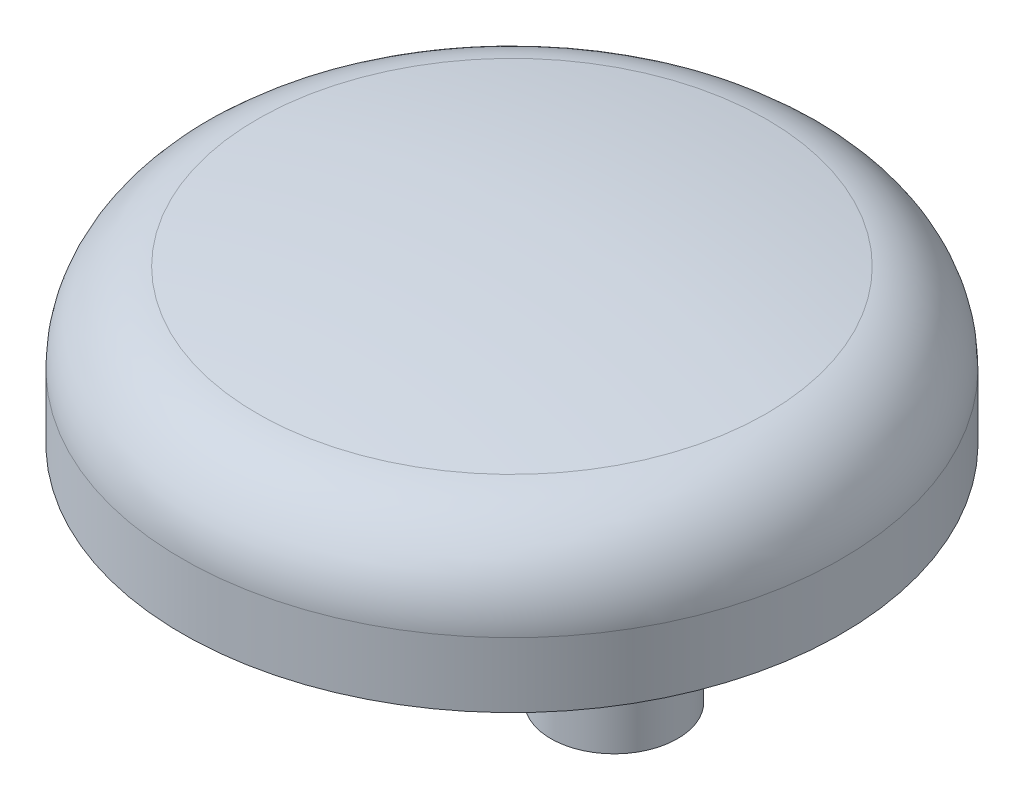
from build123d import *

# Parameters (mm, degrees)
SKETCH4_R           = 6.35
BOSS_EXTRUDE2_DEPTH = 21.082


with BuildPart() as part:
    # Sketch3 → Revolve1 (revolve)
    with BuildSketch(Plane.XY):
        with BuildLine():
            Line((0, 0), (33.02, 0))
            Line((33.02, 0), (33.02, 6.49997073))
            ThreePointArc((33.02, 6.49997073), (30.896328324, 12.306528126), (25.527531381, 15.372814081))
            ThreePointArc((25.527531381, 15.372814081), (12.809089234, 16.986749481), (0, 17.526))
            Line((0, 17.526), (0, 0))
        make_face()
    revolve(axis=Axis((0, -21.575765897, 0), (0, 1, 0)))

    # Sketch4 → Boss-Extrude2 (add)
    with BuildSketch(Plane.XZ):
        with Locations((6.477, -3.77)):
            Circle(SKETCH4_R)
    extrude(amount=BOSS_EXTRUDE2_DEPTH)


solid = part.part
